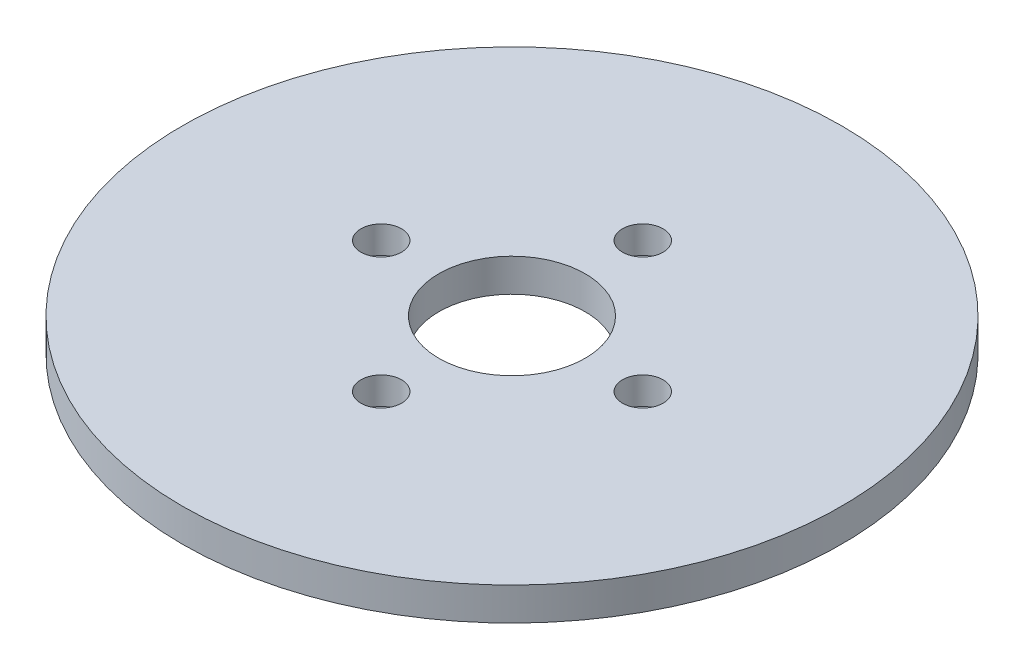
from build123d import *

# Parameters (mm, degrees)
SKETCH1_R           = 90
BOSS_EXTRUDE1_DEPTH = 9
SKETCH2_R           = 20
CUT_EXTRUDE1_DEPTH  = 128.597021909
SKETCH3_R           = 5.55122734
CUT_EXTRUDE2_DEPTH  = 7.467658598
CIRPATTERN1_COUNT   = 4


with BuildPart() as part:
    # Sketch1 → Boss-Extrude1 (new body)
    with BuildSketch(Plane(origin=(0, 0, 0), x_dir=(1, 0, 0), z_dir=(0, 1, 0))):
        Circle(SKETCH1_R)
    extrude(amount=BOSS_EXTRUDE1_DEPTH)

    # Sketch2 → Cut-Extrude1 (cut, through all)
    with BuildSketch(Plane(origin=(0, 0, 0), x_dir=(1, 0, 0), z_dir=(0, 1, 0))):
        Circle(SKETCH2_R)
    extrude(amount=CUT_EXTRUDE1_DEPTH, mode=Mode.SUBTRACT)

    # Sketch3 → Cut-Extrude2 (cut)
    with BuildSketch(Plane(origin=(0, 9, 0), x_dir=(1, 0, 0), z_dir=(0, 1, 0))):
        with Locations((-35.714527572, 0)):
            Circle(SKETCH3_R)
    cut_extrude2 = extrude(amount=-CUT_EXTRUDE2_DEPTH, mode=Mode.SUBTRACT)

    # CirPattern1: Cut-Extrude2 ×4 about axis
    cirpattern1_axis = Axis((0, 0, 0), (0, 1, 0))
    for i in range(1, CIRPATTERN1_COUNT):
        add(cut_extrude2.rotate(cirpattern1_axis, i * 360 / CIRPATTERN1_COUNT), mode=Mode.SUBTRACT)


solid = part.part
